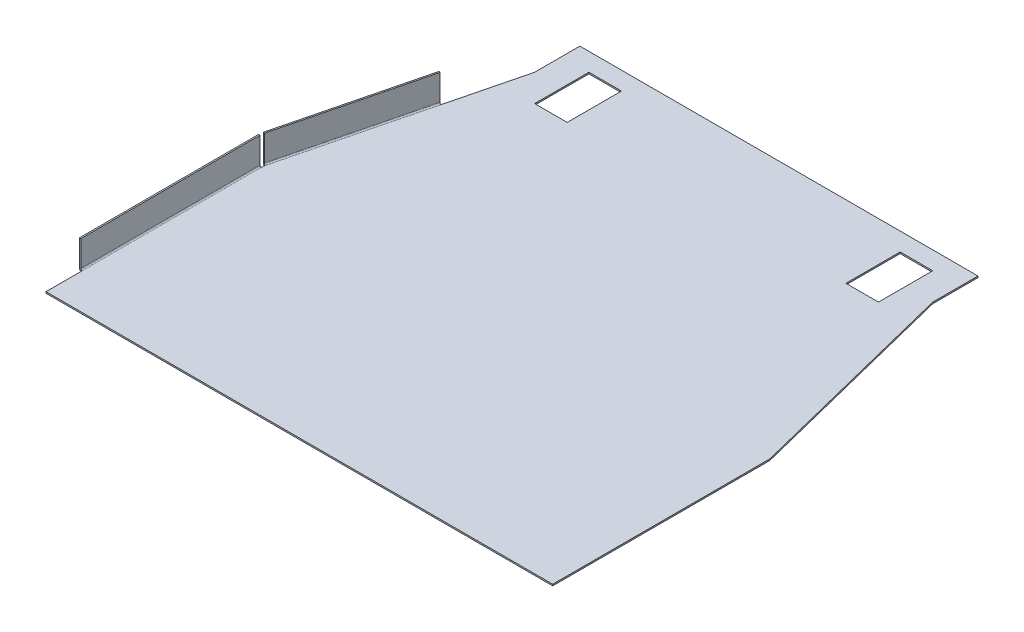
from build123d import *

# Parameters (mm, degrees)
SKETCH7_W          = 280
SKETCH7_H          = 120
BASE_FLANGE4_DEPTH = 0.8
TAB2_DEPTH         = 0.8
SKETCH11_W         = 18
SKETCH11_H         = 30
CUT_EXTRUDE1_DEPTH = 249.245120798
EDGE_FLANGE1_DEPTH = 99
EDGE_FLANGE2_DEPTH = 80


# Sheet-metal steps are written as plain solids
with BuildPart() as part:
    # Sketch7 → Base-Flange4 (new body)
    with BuildSketch(Plane(origin=(0, 0, 0), x_dir=(1, 0, 0), z_dir=(0, 1, 0))):
        Rectangle(SKETCH7_W, SKETCH7_H)
    extrude(amount=-BASE_FLANGE4_DEPTH)

    # Sketch10 → Tab2 (add)
    with BuildSketch(Plane(origin=(0, 0, 0), x_dir=(1, 0, 0), z_dir=(0, 1, 0))):
        Polygon((140, 60), (-140, 60), (-110, 180), (-110, 205), (110, 205), (110, 180), align=None)
    extrude(amount=-TAB2_DEPTH)

    # Sketch11 → Cut-Extrude1 (cut, through all)
    with BuildSketch(Plane(origin=(0, 0, 0), x_dir=(1, 0, 0), z_dir=(0, 1, 0))):
        with Locations((-86, 180)):
            Rectangle(SKETCH11_W, SKETCH11_H)
        with Locations((86, 180)):
            Rectangle(SKETCH11_W, SKETCH11_H)
    extrude(amount=-CUT_EXTRUDE1_DEPTH, mode=Mode.SUBTRACT)

    # Edge-Flange1 section (across the edge) → Edge-Flange1 (add)
    with BuildSketch(Plane(origin=(-140.7366, 0, -59), x_dir=(1, 0, 0), z_dir=(0, 0, 1))):
        with BuildLine():
            Line((-0.8, 0.7366), (-0.8, 15))
            Line((-0.8, 15), (0, 15))
            Line((0, 15), (0, 0.7366))
            ThreePointArc((0, 0.7366), (0.215745145, 0.215745145), (0.7366, 0))
            Line((0.7366, 0), (0.7366, -0.8))
            ThreePointArc((0.7366, -0.8), (-0.34994028, -0.34994028), (-0.8, 0.7366))
        make_face()
    extrude(amount=EDGE_FLANGE1_DEPTH)

    # Edge-Flange2 section (across the edge) → Edge-Flange2 (add)
    with BuildSketch(Plane(origin=(-121.069221338, 0, -138.760194253), x_dir=(0.9701425001453319, 3.4914813388431334e-15, 0.24253562503633339), z_dir=(-0.24253562503633339, 0, 0.9701425001453319))):
        with BuildLine():
            Line((-0.8, 0.7366), (-0.8, 15))
            Line((-0.8, 15), (0, 15))
            Line((0, 15), (0, 0.7366))
            ThreePointArc((0, 0.7366), (0.215745145, 0.215745145), (0.7366, 0))
            Line((0.7366, 0), (0.7366, -0.8))
            ThreePointArc((0.7366, -0.8), (-0.34994028, -0.34994028), (-0.8, 0.7366))
        make_face()
    extrude(amount=EDGE_FLANGE2_DEPTH)


solid = part.part
